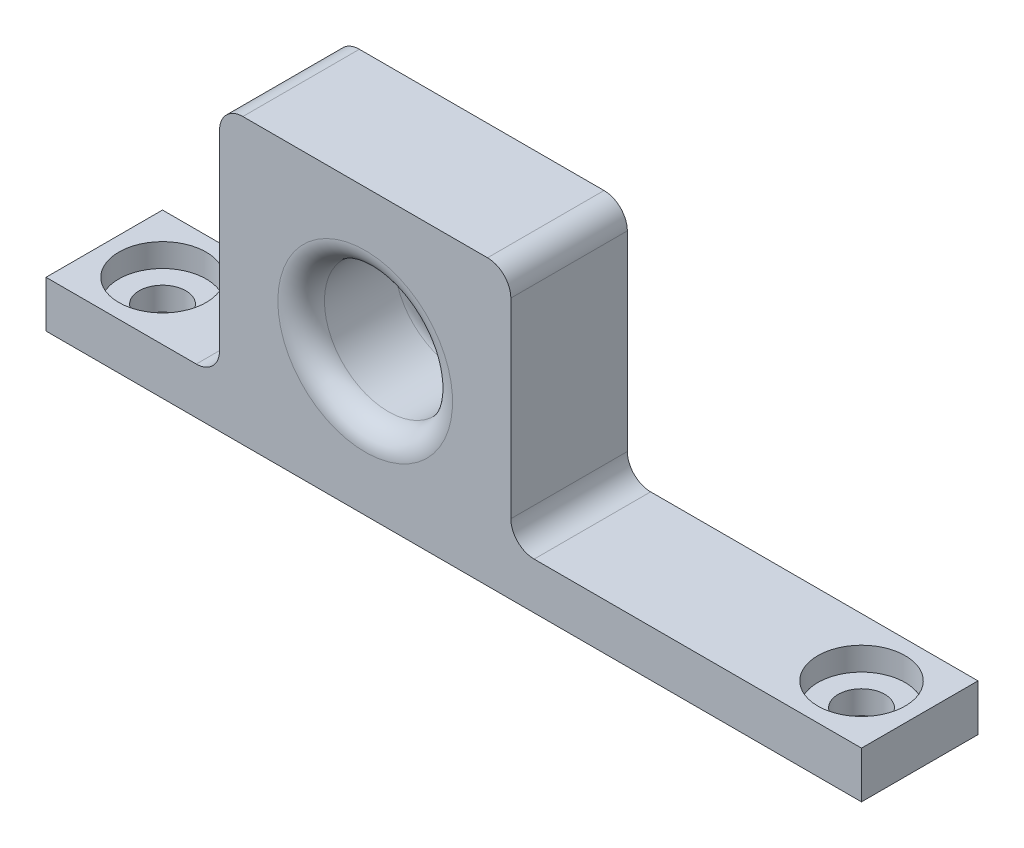
from build123d import *

# Parameters (mm, degrees)
SKETCH1_W           = 88.9
SKETCH1_H           = 12.7
SKETCH1_R           = 2.54
BOSS_EXTRUDE2_DEPTH = 5.08
SKETCH3_R           = 4.7625
CUT_EXTRUDE1_DEPTH  = 2.54
SKETCH4_W           = 31.75
SKETCH4_H           = 30.988
SKETCH4_R           = 6.985
BOSS_EXTRUDE3_DEPTH = 12.7
FILLET1_R           = 2.54


with BuildPart() as part:
    # Sketch1 → Boss-Extrude2 (new body)
    with BuildSketch(Plane(origin=(0, 0, 0), x_dir=(1, 0, 0), z_dir=(0, 1, 0))):
        with Locations((44.45, 6.35)):
            Rectangle(SKETCH1_W, SKETCH1_H)
        with Locations((6.35, 6.35)):
            Circle(SKETCH1_R, mode=Mode.SUBTRACT)
        with Locations((82.55, 6.35)):
            Circle(SKETCH1_R, mode=Mode.SUBTRACT)
    extrude(amount=BOSS_EXTRUDE2_DEPTH)

    # Sketch3 → Cut-Extrude1 (cut)
    with BuildSketch(Plane(origin=(0, 5.08, 0), x_dir=(1, 0, 0), z_dir=(0, 1, 0))):
        with Locations((6.35, 6.35)):
            Circle(SKETCH3_R)
        with Locations((82.55, 6.35)):
            Circle(SKETCH3_R)
    extrude(amount=-CUT_EXTRUDE1_DEPTH, mode=Mode.SUBTRACT)

    # Sketch4 → Boss-Extrude3 (add)
    with BuildSketch(Plane.XY):
        with Locations((34.798, 15.494)):
            Rectangle(SKETCH4_W, SKETCH4_H)
        with Locations((34.798, 15.494)):
            Circle(SKETCH4_R, mode=Mode.SUBTRACT)
    extrude(amount=-BOSS_EXTRUDE3_DEPTH)

    # Fillet1
    fillet1_edges = [part.edges().sort_by_distance(p)[0] for p in [
        (27.813, 15.494, 0),
        (27.813, 15.494, -12.7),
        (50.673, 5.08, -6.35),
        (50.673, 30.988, -6.35),
        (18.923, 30.988, -6.35),
        (18.923, 5.08, -6.35),
    ]]
    fillet(fillet1_edges, radius=FILLET1_R)


solid = part.part
